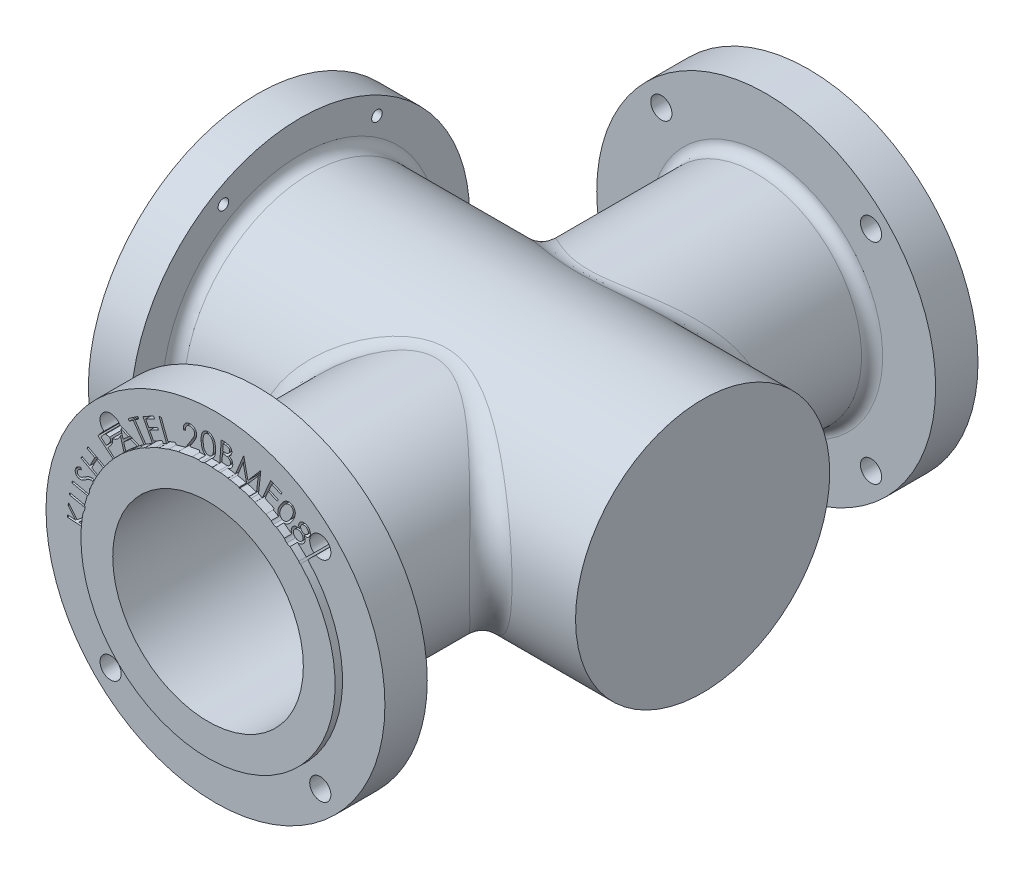
from build123d import *

# Parameters (mm, degrees)
SKETCH4_R          = 0.5
CUT_EXTRUDE1_DEPTH = 31.849473253
CUT_EXTRUDE2_REACH = 28.663
SKETCH5_R          = 0.25
SKETCH6_R          = 4.5
CUT_EXTRUDE3_DEPTH = 19
SKETCH4_3_R        = 4.5
CUT_EXTRUDE4_DEPTH = 33.119931507
FILLET1_R          = 1
CUT_EXTRUDE7_DEPTH = 2


with BuildPart() as part:
    # Sketch1 → Revolve1 (revolve)
    with BuildSketch(Plane(origin=(0, 0, 0), x_dir=(1, 0, 0), z_dir=(0, 1, 0))):
        with BuildLine():
            Line((0, -14.35), (6, -14.35))
            Line((6, -14.35), (6, -14))
            Line((6, -14), (8, -14))
            Line((8, -14), (8, -12))
            Line((8, -12), (5.5, -12))
            ThreePointArc((5.5, -12), (5.146446609, -11.853553391), (5, -11.5))
            Line((5, -11.5), (5, 11.5))
            ThreePointArc((5, 11.5), (5.146446609, 11.853553391), (5.5, 12))
            Line((5.5, 12), (8, 12))
            Line((8, 12), (8, 14))
            Line((8, 14), (6, 14))
            Line((6, 14), (6, 14.35))
            Line((6, 14.35), (0, 14.35))
            Line((0, 14.35), (0, -14.35))
        make_face()
    revolve(axis=Axis((0, 0, -14), (0, 0, 1)))

    # Sketch4 → Cut-Extrude1 (cut, through all)
    with BuildSketch(Plane.XY.offset(14.35)):
        with Locations((4.949747468, 4.949747468)):
            Circle(SKETCH4_R)
        with Locations((4.949747468, -4.949747468)):
            Circle(SKETCH4_R)
        with Locations((-4.949747468, -4.949747468)):
            Circle(SKETCH4_R)
        with Locations((-4.949747468, 4.949747468)):
            Circle(SKETCH4_R)
    extrude(amount=-CUT_EXTRUDE1_DEPTH, mode=Mode.SUBTRACT)

    # Sketch1<3> → Revolve2 (revolve)
    with BuildSketch(Plane(origin=(0, 0, 0), x_dir=(1, 0, 0), z_dir=(0, 1, 0))):
        with BuildLine():
            Line((-10, 0), (9, 0))
            Line((9, 0), (9, 6))
            Line((9, 6), (-9.5, 6))
            ThreePointArc((-9.5, 6), (-9.853553391, 6.146446609), (-10, 6.5))
            Line((-10, 6.5), (-10, 8))
            Line((-10, 8), (-12, 8))
            Line((-12, 8), (-12, 6))
            Line((-12, 6), (-11, 6))
            Line((-11, 6), (-11, 0))
            Line((-11, 0), (-10, 0))
        make_face()
    revolve(axis=Axis((-1024, 0, 0), (1, 0, 0)))

    # Sketch5 → Cut-Extrude2 (cut, up to next)
    with BuildSketch(Plane.ZY.offset(12), mode=Mode.PRIVATE) as cut_extrude2_sk1:
        with Locations((7.25, 0)):
            Circle(SKETCH5_R)
    cut_extrude2_tool1 = extrude(cut_extrude2_sk1.sketch, amount=-CUT_EXTRUDE2_REACH, mode=Mode.PRIVATE) & part.part
    # Sketch5 → Cut-Extrude2 (cut, up to next)
    with BuildSketch(Plane.ZY.offset(12), mode=Mode.PRIVATE) as cut_extrude2_sk2:
        with Locations((3.625, -6.278684177)):
            Circle(SKETCH5_R)
    cut_extrude2_tool2 = extrude(cut_extrude2_sk2.sketch, amount=-CUT_EXTRUDE2_REACH, mode=Mode.PRIVATE) & part.part
    # Sketch5 → Cut-Extrude2 (cut, up to next)
    with BuildSketch(Plane.ZY.offset(12), mode=Mode.PRIVATE) as cut_extrude2_sk3:
        with Locations((-3.625, -6.278684177)):
            Circle(SKETCH5_R)
    cut_extrude2_tool3 = extrude(cut_extrude2_sk3.sketch, amount=-CUT_EXTRUDE2_REACH, mode=Mode.PRIVATE) & part.part
    # Sketch5 → Cut-Extrude2 (cut, up to next)
    with BuildSketch(Plane.ZY.offset(12), mode=Mode.PRIVATE) as cut_extrude2_sk4:
        with Locations((-7.25, 0)):
            Circle(SKETCH5_R)
    cut_extrude2_tool4 = extrude(cut_extrude2_sk4.sketch, amount=-CUT_EXTRUDE2_REACH, mode=Mode.PRIVATE) & part.part
    # Sketch5 → Cut-Extrude2 (cut, up to next)
    with BuildSketch(Plane.ZY.offset(12), mode=Mode.PRIVATE) as cut_extrude2_sk5:
        with Locations((-3.625, 6.278684177)):
            Circle(SKETCH5_R)
    cut_extrude2_tool5 = extrude(cut_extrude2_sk5.sketch, amount=-CUT_EXTRUDE2_REACH, mode=Mode.PRIVATE) & part.part
    # Sketch5 → Cut-Extrude2 (cut, up to next)
    with BuildSketch(Plane.ZY.offset(12), mode=Mode.PRIVATE) as cut_extrude2_sk6:
        with Locations((3.625, 6.278684177)):
            Circle(SKETCH5_R)
    cut_extrude2_tool6 = extrude(cut_extrude2_sk6.sketch, amount=-CUT_EXTRUDE2_REACH, mode=Mode.PRIVATE) & part.part
    add(cut_extrude2_tool1.solids().sort_by_distance((-12, 0, 7.25))[0], mode=Mode.SUBTRACT)
    add(cut_extrude2_tool2.solids().sort_by_distance((-12, -6.278684, 3.625))[0], mode=Mode.SUBTRACT)
    add(cut_extrude2_tool3.solids().sort_by_distance((-12, -6.278684, -3.625))[0], mode=Mode.SUBTRACT)
    add(cut_extrude2_tool4.solids().sort_by_distance((-12, 0, -7.25))[0], mode=Mode.SUBTRACT)
    add(cut_extrude2_tool5.solids().sort_by_distance((-12, 6.278684, -3.625))[0], mode=Mode.SUBTRACT)
    add(cut_extrude2_tool6.solids().sort_by_distance((-12, 6.278684, 3.625))[0], mode=Mode.SUBTRACT)

    # Sketch6 → Cut-Extrude3 (cut)
    with BuildSketch(Plane.ZY.offset(11)):
        Circle(SKETCH6_R)
    extrude(amount=-CUT_EXTRUDE3_DEPTH, mode=Mode.SUBTRACT)

    # Sketch4<3> → Cut-Extrude4 (cut, through all)
    with BuildSketch(Plane.XY.offset(14.35)):
        Circle(SKETCH4_3_R)
    extrude(amount=-CUT_EXTRUDE4_DEPTH, mode=Mode.SUBTRACT)

    # Fillet1
    fillet1_edges = [part.edges().sort_by_distance(p)[0] for p in [
        (-5.000000001, 1e-09, 6.000000004),
        (0, 5, -3.31662479),
    ]]
    fillet(fillet1_edges, radius=FILLET1_R)

    # Sketch8 → Cut-Extrude7 (cut)
    # profile 1 of 17: a face of its own
    with BuildSketch(Plane.XY.offset(14.35)):
        Polygon((-6.986378205, 0.188701923), (-6.979366987, 0.290064103), (-6.606169872, 0.264623397), (-6.952323718, 0.687099359), (-6.943108974, 0.821514423), (-6.529447115, 0.313301282), (-5.946113782, 0.791065705), (-5.955128205, 0.659254808), (-6.448517628, 0.25400641), (-5.984775641, 0.222355769), (-5.991786859, 0.12099359), align=None)
    # profile 2 of 17: a face of its own
    with BuildSketch(Plane.XY.offset(14.35)):
        with BuildLine():
            Line((-6.89383186, 1.150157406), (-6.872798206, 1.247513175))
            Line((-6.872798206, 1.247513175), (-6.283455258, 1.120109329))
            add(Edge.make_bspline(
                [(-6.283455258, 1.120109329), (-6.275113129, 1.118284896), (-6.259312483, 1.114829277), (-6.236789655, 1.110248316), (-6.216696765, 1.106211393), (-6.1990805, 1.10280187), (-6.183847904, 1.10016267), (-6.171092175, 1.098164729), (-6.160744833, 1.096707811), (-6.154651037, 1.096121349), (-6.152045001, 1.095870547)],
                knots=[0, 0, 0, 0, 1.532957629, 2.90354203, 4.126002499, 5.212152315, 6.124598794, 6.901088842, 7.530046284, 8, 8, 8, 8], degree=3))
            add(Edge.make_bspline(
                [(-6.152045001, 1.095870547), (-6.142431305, 1.095328928), (-6.123856776, 1.094282471), (-6.096774497, 1.096147051), (-6.071510455, 1.100642662), (-6.047835243, 1.108302266), (-6.025466726, 1.119632168), (-6.004208802, 1.134817655), (-5.983820633, 1.153941471), (-5.964895702, 1.176473373), (-5.947585811, 1.201103346), (-5.933346901, 1.227169714), (-5.922284284, 1.254058721), (-5.917465799, 1.272555308), (-5.915065835, 1.281767982)],
                knots=[0, 0, 0, 0, 1.045648797, 2.020287966, 2.942650699, 3.828489792, 4.714507224, 5.656837994, 6.658130493, 7.74439148, 8.849613514, 9.924567605, 10.966280446, 12, 12, 12, 12], degree=3))
            add(Edge.make_bspline(
                [(-5.915065835, 1.281767982), (-5.913613019, 1.289824832), (-5.910711362, 1.305916483), (-5.909667142, 1.330387798), (-5.910974814, 1.354915983), (-5.91532614, 1.379176399), (-5.921663609, 1.402937261), (-5.931153395, 1.425309811), (-5.942437452, 1.446489708), (-5.956539148, 1.466056441), (-5.97266066, 1.48432535), (-5.991409709, 1.50081688), (-6.012199405, 1.516043789), (-6.027602648, 1.524334503), (-6.035458463, 1.528562854)],
                knots=[0, 0, 0, 0, 0.994086842, 1.985453153, 2.969148558, 3.973879984, 4.976149835, 5.951337553, 6.921004498, 7.887132501, 8.875904043, 9.876134418, 10.916806393, 12, 12, 12, 12], degree=3))
            add(Edge.make_bspline(
                [(-6.035458463, 1.528562854), (-6.038776983, 1.530145465), (-6.046160516, 1.533666691), (-6.058803499, 1.538317002), (-6.073873433, 1.543259992), (-6.091303085, 1.548779407), (-6.111393744, 1.554081262), (-6.134002749, 1.559597983), (-6.159047177, 1.565754168), (-6.176672498, 1.569480663), (-6.185899168, 1.571431444)],
                knots=[0, 0, 0, 0, 0.562762342, 1.252116398, 2.060496101, 2.991951591, 4.051095601, 5.241496129, 6.555952349, 8, 8, 8, 8], degree=3))
            Line((-6.185899168, 1.571431444), (-6.775242117, 1.69883529))
            Line((-6.775242117, 1.69883529), (-6.754208463, 1.79639138))
            Line((-6.754208463, 1.79639138), (-6.164865514, 1.668987534))
            add(Edge.make_bspline(
                [(-6.164865514, 1.668987534), (-6.15423107, 1.666657567), (-6.133486481, 1.662112505), (-6.103454501, 1.654235979), (-6.075136973, 1.646007359), (-6.04848372, 1.637503919), (-6.023650576, 1.628266119), (-6.000541976, 1.618617234), (-5.979056846, 1.608711569), (-5.959265668, 1.597991143), (-5.940654771, 1.586480892), (-5.923363392, 1.573471521), (-5.906928443, 1.559167284), (-5.891689527, 1.543191269), (-5.877323439, 1.525880704), (-5.864023298, 1.507009664), (-5.851586092, 1.486867823), (-5.840495948, 1.465272559), (-5.83051475, 1.442796125), (-5.823031882, 1.419317231), (-5.817354312, 1.395347444), (-5.813700205, 1.370759392), (-5.812317279, 1.345546309), (-5.813234997, 1.319699073), (-5.815940132, 1.293299794), (-5.819375939, 1.275670029), (-5.821115514, 1.266743944)],
                knots=[0, 0, 0, 0, 1.301440194, 2.538716735, 3.710954634, 4.826818693, 5.882641336, 6.877457842, 7.820308208, 8.709733787, 9.566941146, 10.433906613, 11.293786257, 12.168909599, 13.070433856, 13.980821628, 14.92691088, 15.898096168, 16.881346332, 17.863396679, 18.839327867, 19.823808754, 20.831229657, 21.853564497, 22.913243158, 24, 24, 24, 24], degree=3))
            add(Edge.make_bspline(
                [(-5.821115514, 1.266743944), (-5.823397095, 1.257096139), (-5.827871166, 1.238177252), (-5.836578919, 1.210735062), (-5.846762605, 1.184778119), (-5.858341117, 1.16009293), (-5.871889682, 1.137115007), (-5.886612936, 1.115329174), (-5.903259914, 1.095291408), (-5.920911874, 1.076458327), (-5.939929303, 1.059497464), (-5.959800036, 1.044385583), (-5.980465125, 1.031349529), (-6.001909087, 1.020237623), (-6.024042711, 1.010950949), (-6.047050012, 1.004081864), (-6.070633717, 0.998564132), (-6.086779073, 0.996935518), (-6.094953655, 0.996110931)],
                knots=[0, 0, 0, 0, 1.150827783, 2.256718528, 3.339427705, 4.386775717, 5.418685421, 6.433738576, 7.436398037, 8.44004624, 9.42839463, 10.391358605, 11.335664093, 12.261551904, 13.193135547, 14.117723957, 15.046981706, 16, 16, 16, 16], degree=3))
            add(Edge.make_bspline(
                [(-6.094953655, 0.996110931), (-6.100494039, 0.995762995), (-6.112436538, 0.995013005), (-6.131840136, 0.995624037), (-6.153895768, 0.997201978), (-6.178720127, 1.000197638), (-6.206283344, 1.003841807), (-6.236547403, 1.009284143), (-6.26963665, 1.01538498), (-6.292547065, 1.020228775), (-6.304488912, 1.022753559)],
                knots=[0, 0, 0, 0, 0.628687708, 1.355159219, 2.197137972, 3.133736281, 4.187661874, 5.346904728, 6.617098126, 8, 8, 8, 8], degree=3))
            Line((-6.304488912, 1.022753559), (-6.89383186, 1.150157406))
        make_face()
    # profile 3 of 17: a face of its own
    with BuildSketch(Plane.XY.offset(14.35)):
        with BuildLine():
            Line((-5.921266068, 1.785307668), (-5.940296517, 1.882463117))
            add(Edge.make_bspline(
                [(-5.940296517, 1.882463117), (-5.925548339, 1.885001654), (-5.897332042, 1.889858397), (-5.857692202, 1.901036532), (-5.822303109, 1.914163946), (-5.79164964, 1.930477477), (-5.76530141, 1.949097951), (-5.743860969, 1.97065239), (-5.726302296, 1.994519518), (-5.718863129, 2.012485146), (-5.715136261, 2.021485553)],
                knots=[0, 0, 0, 0, 1.291542476, 2.470986435, 3.551556088, 4.544751696, 5.461789055, 6.326226313, 7.161474144, 8, 8, 8, 8], degree=3))
            add(Edge.make_bspline(
                [(-5.715136261, 2.021485553), (-5.712599728, 2.029378983), (-5.707575435, 2.045014068), (-5.703579985, 2.069277798), (-5.702866252, 2.093705362), (-5.704871253, 2.118027254), (-5.709455236, 2.141737571), (-5.717412941, 2.163915897), (-5.727843021, 2.184425963), (-5.741116325, 2.202840095), (-5.756567972, 2.218970225), (-5.773466483, 2.232999906), (-5.792096994, 2.244421131), (-5.805528179, 2.249897629), (-5.812291709, 2.252655424)],
                knots=[0, 0, 0, 0, 1.069680766, 2.118793553, 3.162825689, 4.218439843, 5.26531734, 6.271775718, 7.251424329, 8.227841336, 9.191609424, 10.129052576, 11.057848535, 12, 12, 12, 12], degree=3))
            add(Edge.make_bspline(
                [(-5.812291709, 2.252655424), (-5.820311372, 2.255075979), (-5.836504847, 2.259963614), (-5.862359571, 2.262126864), (-5.88931566, 2.260346891), (-5.907222416, 2.25606557), (-5.916458376, 2.253857347)],
                knots=[0, 0, 0, 0, 0.948140302, 1.914505363, 2.924341997, 4, 4, 4, 4], degree=3))
            add(Edge.make_bspline(
                [(-5.916458376, 2.253857347), (-5.923300139, 2.251811119), (-5.937677663, 2.2475111), (-5.959639525, 2.238864975), (-5.983401635, 2.228739804), (-6.00850997, 2.216128219), (-6.035491822, 2.202000497), (-6.063819858, 2.185358927), (-6.094099613, 2.167319929), (-6.114484957, 2.154100454), (-6.12499203, 2.147286835)],
                knots=[0, 0, 0, 0, 0.729038284, 1.532027095, 2.408696707, 3.366372863, 4.400564, 5.518828321, 6.721147285, 8, 8, 8, 8], degree=3))
            add(Edge.make_bspline(
                [(-6.12499203, 2.147286835), (-6.135451674, 2.140505359), (-6.155473312, 2.127524397), (-6.184488368, 2.10954251), (-6.210920116, 2.093691961), (-6.234776298, 2.079966578), (-6.256170056, 2.068572283), (-6.274933039, 2.059246433), (-6.291260802, 2.052279737), (-6.301453798, 2.048873465), (-6.306081773, 2.047326899)],
                knots=[0, 0, 0, 0, 1.44291698, 2.762002399, 3.95103348, 5.010398315, 5.947461928, 6.756346721, 7.43533801, 8, 8, 8, 8], degree=3))
            add(Edge.make_bspline(
                [(-6.306081773, 2.047326899), (-6.313000094, 2.045353317), (-6.326721263, 2.041439094), (-6.347488716, 2.037460308), (-6.368060817, 2.035250753), (-6.388418356, 2.034657215), (-6.408604388, 2.035562441), (-6.428544867, 2.038498646), (-6.448306622, 2.042768195), (-6.461099553, 2.047132773), (-6.467540107, 2.049330104)],
                knots=[0, 0, 0, 0, 1.049962564, 2.082400182, 3.08252884, 4.067577515, 5.053397718, 6.028117244, 7.007263024, 8, 8, 8, 8], degree=3))
            add(Edge.make_bspline(
                [(-6.467540107, 2.049330104), (-6.47741578, 2.05327181), (-6.49689887, 2.061048152), (-6.523650079, 2.077201261), (-6.548050142, 2.096123629), (-6.569398905, 2.118344285), (-6.587499481, 2.143203167), (-6.601819814, 2.170360364), (-6.612536393, 2.19944185), (-6.619289346, 2.230245299), (-6.621983016, 2.261952389), (-6.621084712, 2.293847897), (-6.615904209, 2.325605171), (-6.609299752, 2.346075089), (-6.605961581, 2.35642145)],
                knots=[0, 0, 0, 0, 1.017242832, 2.006853819, 2.982009248, 3.968306335, 4.948484919, 5.918612277, 6.900230261, 7.909131171, 8.930228882, 9.941499986, 10.959547121, 12, 12, 12, 12], degree=3))
            add(Edge.make_bspline(
                [(-6.605961581, 2.35642145), (-6.601662473, 2.367253735), (-6.593157377, 2.388683677), (-6.575023285, 2.418127061), (-6.553717446, 2.445221947), (-6.53275814, 2.465596258), (-6.513651108, 2.480399496), (-6.497443933, 2.491281653), (-6.479504257, 2.501888812), (-6.459606419, 2.511786921), (-6.438104491, 2.52145199), (-6.414775191, 2.530668391), (-6.389626595, 2.539422591), (-6.372139207, 2.544780253), (-6.36317312, 2.547527219)],
                knots=[0, 0, 0, 0, 1.299858522, 2.571561987, 3.846150426, 5.143973717, 5.824429192, 6.544462836, 7.323629782, 8.151015956, 9.025872352, 9.956787822, 10.952409612, 12, 12, 12, 12], degree=3))
            Line((-6.36317312, 2.547527219), (-6.332724402, 2.449971129))
            add(Edge.make_bspline(
                [(-6.332724402, 2.449971129), (-6.339880043, 2.447667102), (-6.353709908, 2.443214058), (-6.373501642, 2.436250042), (-6.391589977, 2.429197845), (-6.408096168, 2.422266069), (-6.422894771, 2.415024281), (-6.436115549, 2.407894153), (-6.447688658, 2.400680956), (-6.460624098, 2.390883932), (-6.474552408, 2.377663364), (-6.489123874, 2.360305343), (-6.500752907, 2.340736568), (-6.506508741, 2.326653839), (-6.509407094, 2.319562476)],
                knots=[0, 0, 0, 0, 1.18227372, 2.28500623, 3.29911749, 4.235422685, 5.099633425, 5.889151834, 6.597143472, 7.241953614, 8.438091905, 9.609259377, 10.796141642, 12, 12, 12, 12], degree=3))
            add(Edge.make_bspline(
                [(-6.509407094, 2.319562476), (-6.512289941, 2.310361681), (-6.517864291, 2.292570778), (-6.520355886, 2.265160297), (-6.517221031, 2.238836867), (-6.50931923, 2.213982192), (-6.496593624, 2.191798535), (-6.480425903, 2.17261378), (-6.460020997, 2.157615537), (-6.444463012, 2.151051283), (-6.436490427, 2.147687476)],
                knots=[0, 0, 0, 0, 1.106985595, 2.140497038, 3.138155866, 4.139062771, 5.119537815, 6.06192598, 7.006846904, 8, 8, 8, 8], degree=3))
            add(Edge.make_bspline(
                [(-6.436490427, 2.147687476), (-6.431378933, 2.146038034), (-6.42115278, 2.142738128), (-6.405211755, 2.139824244), (-6.38897857, 2.138355378), (-6.372175874, 2.138786203), (-6.354357188, 2.141265704), (-6.335231684, 2.146243097), (-6.31439444, 2.153226132), (-6.3004185, 2.159571401), (-6.29306094, 2.162911835)],
                knots=[0, 0, 0, 0, 0.868076149, 1.736689806, 2.614922363, 3.500959234, 4.449640816, 5.5185591, 6.693658449, 8, 8, 8, 8], degree=3))
            add(Edge.make_bspline(
                [(-6.29306094, 2.162911835), (-6.290583886, 2.164235572), (-6.284571224, 2.167448738), (-6.274262436, 2.173426391), (-6.261232571, 2.181537751), (-6.245424826, 2.191479356), (-6.227023785, 2.203682626), (-6.205500301, 2.21729731), (-6.181591068, 2.233488206), (-6.164600001, 2.244726545), (-6.155641068, 2.250652219)],
                knots=[0, 0, 0, 0, 0.413285909, 1.003186829, 1.753140866, 2.671827171, 3.751102741, 5.002162888, 6.41932114, 8, 8, 8, 8], degree=3))
            add(Edge.make_bspline(
                [(-6.155641068, 2.250652219), (-6.14471844, 2.257773853), (-6.123550113, 2.271575757), (-6.092401931, 2.290871101), (-6.062570193, 2.307788133), (-6.034258574, 2.322591701), (-6.007419084, 2.335294005), (-5.982062522, 2.345736164), (-5.958285277, 2.354351132), (-5.935593954, 2.360388642), (-5.913938581, 2.364517289), (-5.893042777, 2.367718946), (-5.872542867, 2.369048505), (-5.852532483, 2.369087554), (-5.833043253, 2.367703956), (-5.814099776, 2.364864449), (-5.795587131, 2.360726857), (-5.783617529, 2.356787435), (-5.777636261, 2.354818886)],
                knots=[0, 0, 0, 0, 1.537185454, 2.979103843, 4.318721159, 5.579214294, 6.744818953, 7.817830336, 8.811223562, 9.723960709, 10.5823265, 11.409479176, 12.214305086, 13.00149854, 13.76706188, 14.515185624, 15.25803102, 16, 16, 16, 16], degree=3))
            add(Edge.make_bspline(
                [(-5.777636261, 2.354818886), (-5.7693475, 2.351584138), (-5.752925955, 2.345175513), (-5.729817464, 2.332649505), (-5.708501202, 2.317889178), (-5.688764648, 2.301319617), (-5.670944916, 2.282342438), (-5.654757999, 2.261355189), (-5.640307772, 2.238188163), (-5.627792396, 2.213302324), (-5.617473166, 2.187293176), (-5.609525084, 2.160773803), (-5.604561226, 2.133973781), (-5.602065983, 2.107010753), (-5.602511209, 2.079751795), (-5.605739003, 2.052310427), (-5.61176691, 2.024675369), (-5.617749076, 2.006614041), (-5.620785299, 1.997447091)],
                knots=[0, 0, 0, 0, 0.98476517, 1.950999249, 2.902861342, 3.852652542, 4.799559987, 5.780317957, 6.783762581, 7.818999767, 8.86137143, 9.879319484, 10.880171612, 11.875159053, 12.873685873, 13.893780933, 14.930997517, 16, 16, 16, 16], degree=3))
            add(Edge.make_bspline(
                [(-5.620785299, 1.997447091), (-5.623406868, 1.990453263), (-5.628608561, 1.976576172), (-5.638420444, 1.956733213), (-5.649113492, 1.937711268), (-5.661216331, 1.919740031), (-5.674686753, 1.902926301), (-5.689338675, 1.88705105), (-5.705219989, 1.872206371), (-5.722349934, 1.858250959), (-5.741004263, 1.845393987), (-5.761507397, 1.833752284), (-5.783663271, 1.822900396), (-5.8077737, 1.813415686), (-5.833560967, 1.804712169), (-5.861145799, 1.797230259), (-5.890537271, 1.79051506), (-5.910829767, 1.787076234), (-5.921266068, 1.785307668)],
                knots=[0, 0, 0, 0, 0.922194353, 1.829809992, 2.731256421, 3.616707685, 4.503080733, 5.390412957, 6.283364287, 7.186507682, 8.117807448, 9.078599656, 10.096884565, 11.163062804, 12.276969051, 13.457750052, 14.692537049, 16, 16, 16, 16], degree=3))
        make_face()
    # profile 4 of 17: a face of its own
    with BuildSketch(Plane.XY.offset(14.35)):
        Polygon((-6.346308219, 2.924749148), (-6.29983386, 3.013691456), (-5.929040591, 2.81998152), (-5.694064629, 3.269500751), (-6.064857898, 3.463210686), (-6.018383539, 3.552152994), (-5.134369116, 3.090013571), (-5.180843475, 3.001071263), (-5.607526167, 3.224228315), (-5.842502129, 2.774709084), (-5.415819437, 2.551552033), (-5.462293796, 2.462609725), align=None)
    # profile 5 of 17: a face of its own
    with BuildSketch(Plane.XY.offset(14.35)):
        with BuildLine():
            Line((-5.550941717, 4.238857382), (-5.424940115, 4.391100972))
            add(Edge.make_bspline(
                [(-5.424940115, 4.391100972), (-5.416310019, 4.401560495), (-5.39975585, 4.421623854), (-5.37520618, 4.449730379), (-5.352952743, 4.475263768), (-5.332220515, 4.497556819), (-5.313382466, 4.516918601), (-5.296723553, 4.533745144), (-5.281468502, 4.547167751), (-5.271723564, 4.554864981), (-5.267287871, 4.5583686)],
                knots=[0, 0, 0, 0, 1.413369586, 2.711112281, 3.889678649, 4.943627424, 5.883760668, 6.705675344, 7.410850419, 8, 8, 8, 8], degree=3))
            add(Edge.make_bspline(
                [(-5.267287871, 4.5583686), (-5.261475571, 4.562536818), (-5.249946816, 4.57080452), (-5.231716023, 4.581412229), (-5.212935784, 4.590166607), (-5.193893919, 4.597794338), (-5.174164174, 4.603219671), (-5.154132251, 4.607603463), (-5.133598456, 4.609900956), (-5.112773746, 4.61075228), (-5.091775035, 4.609804403), (-5.070938254, 4.606733697), (-5.050334792, 4.601932658), (-5.030073696, 4.595101295), (-5.010122451, 4.586187759), (-4.99045038, 4.575294752), (-4.971012088, 4.562515159), (-4.958656152, 4.552722545), (-4.952384025, 4.547751613)],
                knots=[0, 0, 0, 0, 1.004276471, 1.99199234, 2.956957625, 3.913177165, 4.869120675, 5.827499713, 6.790776997, 7.766936045, 8.752869031, 9.738400425, 10.721205586, 11.720740736, 12.736860294, 13.786326414, 14.876293924, 16, 16, 16, 16], degree=3))
            add(Edge.make_bspline(
                [(-4.952384025, 4.547751613), (-4.946205641, 4.542519332), (-4.934076972, 4.532247939), (-4.917964281, 4.515268541), (-4.90339332, 4.498027287), (-4.890697833, 4.480190764), (-4.88006734, 4.461728362), (-4.871331499, 4.442687035), (-4.864565304, 4.42307822), (-4.859547207, 4.402970401), (-4.856267586, 4.382594819), (-4.855215264, 4.36200378), (-4.855441682, 4.341282525), (-4.858067108, 4.320414012), (-4.861887369, 4.299310978), (-4.868164187, 4.278254797), (-4.875566822, 4.256893622), (-4.88213766, 4.243075363), (-4.885476974, 4.236052895)],
                knots=[0, 0, 0, 0, 1.118276287, 2.195267141, 3.230436997, 4.236817521, 5.216738488, 6.170760861, 7.128125609, 8.079465628, 9.032371271, 9.975392665, 10.926195304, 11.892416529, 12.878921779, 13.886782431, 14.926058491, 16, 16, 16, 16], degree=3))
            add(Edge.make_bspline(
                [(-4.885476974, 4.236052895), (-4.88842234, 4.230410645), (-4.894834377, 4.218127512), (-4.906661353, 4.198880792), (-4.921063883, 4.177082347), (-4.938404965, 4.152839925), (-4.958479628, 4.126073563), (-4.981059334, 4.096591652), (-5.006539135, 4.064817744), (-5.024541892, 4.042923971), (-5.033914474, 4.031525651)],
                knots=[0, 0, 0, 0, 0.60329799, 1.313374853, 2.140398994, 3.080211623, 4.138740126, 5.312570504, 6.60087243, 8, 8, 8, 8], degree=3))
            Line((-5.033914474, 4.031525651), (-5.078986589, 3.977038472))
            Line((-5.078986589, 3.977038472), (-4.723618, 3.682967959))
            Line((-4.723618, 3.682967959), (-4.786718961, 3.606645844))
            Line((-4.786718961, 3.606645844), (-5.550941717, 4.238857382))
        make_face()
        with BuildLine():
            Line((-5.413722166, 4.253881421), (-5.153906461, 4.03893751))
            Line((-5.153906461, 4.03893751), (-5.045132423, 4.166942318))
            add(Edge.make_bspline(
                [(-5.045132423, 4.166942318), (-5.039940498, 4.17324618), (-5.029899913, 4.185437124), (-5.016176487, 4.203737157), (-5.003617752, 4.220897638), (-4.992895584, 4.237274412), (-4.983551321, 4.25261032), (-4.975709449, 4.26694469), (-4.969436447, 4.280469506), (-4.963028604, 4.297047681), (-4.958093193, 4.31734764), (-4.955661811, 4.341602075), (-4.957646778, 4.365666873), (-4.963035265, 4.389283857), (-4.971870902, 4.411971281), (-4.983893774, 4.433069256), (-4.999183335, 4.452335136), (-5.01143768, 4.463255136), (-5.017688512, 4.468825331)],
                knots=[0, 0, 0, 0, 1.134336033, 2.193675464, 3.177111676, 4.087866661, 4.911922381, 5.671482984, 6.356279105, 6.981638939, 8.138024127, 9.246579916, 10.353582235, 11.476444054, 12.601296494, 13.723084978, 14.838566044, 16, 16, 16, 16], degree=3))
            add(Edge.make_bspline(
                [(-5.017688512, 4.468825331), (-5.024162692, 4.473774839), (-5.036983069, 4.483576011), (-5.058555743, 4.494564047), (-5.081383042, 4.502565613), (-5.105252531, 4.506714191), (-5.129253136, 4.50820227), (-5.152699296, 4.505450741), (-5.175236318, 4.499449033), (-5.193246328, 4.491278593), (-5.207469903, 4.482530666), (-5.218964279, 4.474204644), (-5.231096261, 4.464191508), (-5.243970227, 4.45246696), (-5.25758646, 4.439081991), (-5.271714947, 4.423759247), (-5.286772223, 4.407013117), (-5.296771879, 4.395072617), (-5.30194332, 4.388897446)],
                knots=[0, 0, 0, 0, 1.158579028, 2.294255006, 3.431085105, 4.591302253, 5.733925054, 6.843988252, 7.93747016, 9.044065359, 9.645904889, 10.313637995, 11.063721388, 11.885110351, 12.792952066, 13.782035355, 14.852953311, 16, 16, 16, 16], degree=3))
            Line((-5.30194332, 4.388897446), (-5.413722166, 4.253881421))
        make_face(mode=Mode.SUBTRACT)
    # profile 6 of 17: a face of its own
    with BuildSketch(Plane.XY.offset(14.35)):
        Polygon((-4.600917766, 5.238498582), (-3.595509112, 4.799596339), (-3.675637317, 4.728883198), (-4.009170971, 4.870910441), (-4.330685394, 4.587456916), (-4.230925779, 4.239299864), (-4.314058791, 4.165982557), (-4.619146933, 5.222472941), align=None)
        Polygon((-4.470709433, 5.072633198), (-4.360733471, 4.689019416), (-4.105525138, 4.914179672), align=None, mode=Mode.SUBTRACT)
    # profile 7 of 17: a face of its own
    with BuildSketch(Plane.XY.offset(14.35)):
        Polygon((-4.065430381, 5.574092318), (-4.120318202, 5.653619562), (-3.670798971, 5.964717318), (-3.615911151, 5.885190075), (-3.798603458, 5.758787831), (-3.286183587, 5.018803857), (-3.36971724, 4.960911228), (-3.882137112, 5.700895203), align=None)
    # profile 8 of 17: a face of its own
    with BuildSketch(Plane.XY.offset(14.35)):
        Polygon((-3.427392705, 6.089496819), (-2.920782128, 6.350915088), (-2.875910333, 6.263775665), (-3.294179564, 6.047830153), (-3.151351038, 5.771387845), (-2.736687577, 5.985530473), (-2.692016103, 5.898992011), (-3.106679564, 5.684849383), (-2.927793346, 5.338094576), (-2.513129885, 5.552237204), (-2.468057769, 5.465097781), (-2.971062577, 5.205482396), align=None)
    # profile 9 of 17: a face of its own
    with BuildSketch(Plane.XY.offset(14.35)):
        Polygon((-2.658971585, 6.462726663), (-2.565421906, 6.498183394), (-2.247913893, 5.657838842), (-1.890742419, 5.792654548), (-1.856888252, 5.702910958), (-2.307609406, 5.532638522), align=None)
    # profile 10 of 17: a face of its own
    with BuildSketch(Plane.XY.offset(14.35)):
        with BuildLine():
            Line((-1.415887807, 6.521239028), (-1.509437486, 6.504011464))
            add(Edge.make_bspline(
                [(-1.509437486, 6.504011464), (-1.511067603, 6.515943422), (-1.514263119, 6.539333615), (-1.51510085, 6.574148068), (-1.513247448, 6.607891652), (-1.5079425, 6.640461555), (-1.499992975, 6.672056425), (-1.488670066, 6.702359189), (-1.474374747, 6.731652819), (-1.456959215, 6.759449418), (-1.437351978, 6.785551429), (-1.415561836, 6.809199762), (-1.391804694, 6.830156597), (-1.366137982, 6.848384887), (-1.338622743, 6.863976199), (-1.309203504, 6.876782883), (-1.277885678, 6.887113146), (-1.256084701, 6.891704211), (-1.245014409, 6.894035502)],
                knots=[0, 0, 0, 0, 1.100230273, 2.156779222, 3.178085263, 4.185725765, 5.168862013, 6.152017213, 7.137614286, 8.143848398, 9.146241945, 10.11826572, 11.078466506, 12.03721075, 12.991279115, 13.964433252, 14.966361965, 16, 16, 16, 16], degree=3))
            add(Edge.make_bspline(
                [(-1.245014409, 6.894035502), (-1.234019583, 6.895752181), (-1.212448511, 6.899120184), (-1.180249145, 6.901006626), (-1.149135143, 6.899506634), (-1.119079499, 6.895468437), (-1.090277836, 6.887951814), (-1.062618944, 6.877451939), (-1.036031882, 6.863940062), (-1.010828391, 6.847563406), (-0.987347781, 6.82912421), (-0.966217612, 6.808888468), (-0.947160874, 6.787510962), (-0.930994367, 6.76422986), (-0.916792958, 6.73981243), (-0.905435524, 6.713758166), (-0.896216387, 6.686360955), (-0.892256975, 6.667322916), (-0.890246781, 6.657657297)],
                knots=[0, 0, 0, 0, 1.121414891, 2.200136782, 3.244562734, 4.257449553, 5.2517348, 6.238127589, 7.234575145, 8.252170548, 9.263512837, 10.23956163, 11.198279964, 12.145132898, 13.091937975, 14.041276092, 15.005555265, 16, 16, 16, 16], degree=3))
            add(Edge.make_bspline(
                [(-0.890246781, 6.657657297), (-0.888209055, 6.64393344), (-0.884168059, 6.616717794), (-0.884625192, 6.575402125), (-0.890016098, 6.534493207), (-0.899029411, 6.500551533), (-0.909231363, 6.472695317), (-0.918848538, 6.449598766), (-0.930833937, 6.424681895), (-0.944388485, 6.397421085), (-0.96055658, 6.368412977), (-0.978304441, 6.337034419), (-0.998405987, 6.303850806), (-1.012675309, 6.281166823), (-1.020054473, 6.269436143)],
                knots=[0, 0, 0, 0, 1.187328871, 2.354580148, 3.526324396, 4.715705695, 5.354623197, 6.067641564, 6.858527512, 7.723420889, 8.675985074, 9.703624978, 10.812464348, 12, 12, 12, 12], degree=3))
            Line((-1.020054473, 6.269436143), (-1.214565691, 5.962745438))
            Line((-1.214565691, 5.962745438), (-0.764044858, 6.04547781))
            Line((-0.764044858, 6.04547781), (-0.746817294, 5.951327169))
            Line((-0.746817294, 5.951327169), (-1.409677871, 5.829532297))
            Line((-1.409677871, 5.829532297), (-1.110599345, 6.300886464))
            add(Edge.make_bspline(
                [(-1.110599345, 6.300886464), (-1.103353837, 6.312283477), (-1.089386668, 6.334253506), (-1.069844715, 6.366189981), (-1.052295458, 6.395744196), (-1.036935423, 6.422860161), (-1.023602509, 6.447518434), (-1.012565165, 6.469793725), (-1.003507289, 6.489619202), (-0.994044485, 6.512615893), (-0.98628515, 6.54018087), (-0.980823955, 6.572961458), (-0.980083439, 6.605856624), (-0.983226256, 6.62743452), (-0.984798063, 6.638226208)],
                knots=[0, 0, 0, 0, 1.317001447, 2.538784396, 3.651094325, 4.668783933, 5.577751231, 6.384420757, 7.092557274, 7.70320576, 8.807865072, 9.876269259, 10.937865085, 12, 12, 12, 12], degree=3))
            add(Edge.make_bspline(
                [(-0.984798063, 6.638226208), (-0.986197093, 6.644938682), (-0.988962891, 6.658208841), (-0.995442791, 6.677278416), (-1.003711841, 6.695265706), (-1.013797646, 6.712176461), (-1.025624717, 6.728071238), (-1.039404736, 6.742763119), (-1.054912272, 6.756426594), (-1.071955032, 6.768874593), (-1.09007534, 6.779891818), (-1.108994643, 6.788961115), (-1.128465188, 6.795983386), (-1.148455804, 6.801026984), (-1.168923879, 6.804109922), (-1.189929162, 6.804736022), (-1.211463531, 6.803884409), (-1.225865651, 6.801632112), (-1.233195499, 6.800485823)],
                knots=[0, 0, 0, 0, 0.996595439, 1.970209317, 2.921922716, 3.871353705, 4.828995608, 5.797947767, 6.795678389, 7.831082899, 8.863796325, 9.875982123, 10.877534488, 11.869243347, 12.870560224, 13.881393798, 14.921751664, 16, 16, 16, 16], degree=3))
            add(Edge.make_bspline(
                [(-1.233195499, 6.800485823), (-1.24077961, 6.79889691), (-1.255727167, 6.795765314), (-1.277128596, 6.788609684), (-1.297397103, 6.78012572), (-1.316038066, 6.769301937), (-1.333604621, 6.757136185), (-1.349715564, 6.743009766), (-1.364383435, 6.727021353), (-1.377778664, 6.70952577), (-1.389433167, 6.690376962), (-1.39924377, 6.669921268), (-1.407170199, 6.648207807), (-1.412559785, 6.625170791), (-1.416787484, 6.601047993), (-1.418408598, 6.575552247), (-1.418222846, 6.548774836), (-1.416679987, 6.530580761), (-1.415887807, 6.521239028)],
                knots=[0, 0, 0, 0, 1.000581647, 1.972050723, 2.911369446, 3.835060076, 4.751954011, 5.669253921, 6.597448032, 7.551866023, 8.512350291, 9.488827071, 10.479686842, 11.492657202, 12.542448545, 13.641109363, 14.788829617, 16, 16, 16, 16], degree=3))
        make_face()
    # profile 11 of 17: a face of its own
    with BuildSketch(Plane.XY.offset(14.35)):
        with BuildLine():
            add(Edge.make_bspline(
                [(-0.674102633, 6.459074704), (-0.674829095, 6.475030738), (-0.676238988, 6.505997654), (-0.676227019, 6.551091818), (-0.675554787, 6.593471996), (-0.672529372, 6.63314235), (-0.668795581, 6.670150191), (-0.663111944, 6.704373491), (-0.656183561, 6.73589885), (-0.647764235, 6.764949715), (-0.63784814, 6.791801835), (-0.626722216, 6.816873136), (-0.614925816, 6.840637221), (-0.601263536, 6.862456223), (-0.587019665, 6.883009419), (-0.57118925, 6.901706914), (-0.554416024, 6.919025143), (-0.536341748, 6.934556842), (-0.517549944, 6.948683897), (-0.497830018, 6.960864005), (-0.477553429, 6.971520457), (-0.456645956, 6.980640652), (-0.434981896, 6.987845173), (-0.412648652, 6.993182359), (-0.389769956, 6.997152055), (-0.374238067, 6.998206665), (-0.366410325, 6.998738165)],
                knots=[0, 0, 0, 0, 1.64556112, 3.193647602, 4.645801909, 6.011505722, 7.29178083, 8.477193657, 9.583919874, 10.615967335, 11.591177859, 12.530788289, 13.441592507, 14.32189666, 15.180917321, 16.016047168, 16.843174529, 17.662596816, 18.468974596, 19.263196791, 20.047975224, 20.827639856, 21.610908808, 22.396892738, 23.192068024, 24, 24, 24, 24], degree=3))
            add(Edge.make_bspline(
                [(-0.366410325, 6.998738165), (-0.358462223, 6.999023508), (-0.34268246, 6.999590013), (-0.319185114, 6.997757923), (-0.296133032, 6.994674155), (-0.273606523, 6.989661522), (-0.251652695, 6.98267378), (-0.229950088, 6.974436019), (-0.208972842, 6.96385583), (-0.188419224, 6.951854839), (-0.16859694, 6.937988292), (-0.149513032, 6.922449074), (-0.131672453, 6.90472492), (-0.114364674, 6.88565457), (-0.098387356, 6.864390073), (-0.083111891, 6.841571833), (-0.068904218, 6.816854701), (-0.055678989, 6.790296706), (-0.043266047, 6.7617167), (-0.032606653, 6.730580202), (-0.023027372, 6.697074834), (-0.014510222, 6.661149961), (-0.007898988, 6.622648813), (-0.002311142, 6.581758465), (0.002176734, 6.538471308), (0.003899971, 6.508763118), (0.004783585, 6.493529832)],
                knots=[0, 0, 0, 0, 0.813536462, 1.61515445, 2.408805851, 3.193219482, 3.973691911, 4.765781671, 5.566699913, 6.375599818, 7.200457923, 8.040665499, 8.891400776, 9.772408456, 10.674717117, 11.611252103, 12.582034029, 13.590816833, 14.647224041, 15.769179429, 16.956920752, 18.213700585, 19.546530676, 20.954041234, 22.438142453, 24, 24, 24, 24], degree=3))
            add(Edge.make_bspline(
                [(0.004783585, 6.493529832), (0.005411168, 6.478308205), (0.006632944, 6.448674803), (0.006866647, 6.405310329), (0.005511678, 6.364276566), (0.002562354, 6.325501027), (-0.002056106, 6.28907759), (-0.007965943, 6.254874884), (-0.015568445, 6.223040099), (-0.024582855, 6.19339282), (-0.035084909, 6.16580734), (-0.046738915, 6.139964403), (-0.059247399, 6.115631931), (-0.073225771, 6.093080136), (-0.088146223, 6.072025146), (-0.104396125, 6.052689026), (-0.122004428, 6.035278021), (-0.140313683, 6.019133174), (-0.159845492, 6.005043224), (-0.179780103, 5.992267003), (-0.200598367, 5.981697914), (-0.221924889, 5.972590869), (-0.243890114, 5.965200571), (-0.266521398, 5.959543396), (-0.289771629, 5.955671126), (-0.305566054, 5.954604314), (-0.31352571, 5.954066691)],
                knots=[0, 0, 0, 0, 1.560143626, 3.037281261, 4.43999632, 5.763812194, 7.018323128, 8.1988359, 9.316783416, 10.368094332, 11.370189389, 12.337424016, 13.270325416, 14.169923165, 15.052331653, 15.911295274, 16.752684233, 17.586423788, 18.408470472, 19.216719548, 20.00886777, 20.796368012, 21.590020231, 22.379507352, 23.183347026, 24, 24, 24, 24], degree=3))
            add(Edge.make_bspline(
                [(-0.31352571, 5.954066691), (-0.321405698, 5.95380272), (-0.336978444, 5.953281049), (-0.360158989, 5.954779997), (-0.382808154, 5.957932988), (-0.404894141, 5.962994347), (-0.42643246, 5.969672162), (-0.447628372, 5.977820269), (-0.468155998, 5.988149379), (-0.488287648, 5.999891007), (-0.507484828, 6.013624202), (-0.526015768, 6.028822689), (-0.543478803, 6.045939003), (-0.559867483, 6.064824592), (-0.575386374, 6.08533482), (-0.58978455, 6.107701184), (-0.60335528, 6.131711482), (-0.616203526, 6.157547895), (-0.627509645, 6.185800865), (-0.638104639, 6.216546871), (-0.64681885, 6.250240448), (-0.655034733, 6.286598513), (-0.661357734, 6.325838728), (-0.667123689, 6.367758132), (-0.671180863, 6.412487236), (-0.673109828, 6.443244482), (-0.674102633, 6.459074704)],
                knots=[0, 0, 0, 0, 0.813176699, 1.60703219, 2.393406672, 3.170672263, 3.94220557, 4.718890667, 5.510830076, 6.31085147, 7.121455188, 7.943689396, 8.781765299, 9.641264234, 10.521853784, 11.433490072, 12.383857329, 13.366860147, 14.40839581, 15.521841224, 16.720225377, 17.99746812, 19.366982446, 20.819929186, 22.363272685, 24, 24, 24, 24], degree=3))
        make_face()
        with BuildLine():
            add(Edge.make_bspline(
                [(-0.579751672, 6.461879191), (-0.578933946, 6.448254131), (-0.577353465, 6.421919927), (-0.574236057, 6.383692168), (-0.57006518, 6.348148653), (-0.564963862, 6.315173428), (-0.559595143, 6.284759602), (-0.55287926, 6.256982238), (-0.545624378, 6.231786711), (-0.537324804, 6.209052965), (-0.528118753, 6.188400009), (-0.518498402, 6.169107281), (-0.507472941, 6.151495737), (-0.496118079, 6.134882852), (-0.48369617, 6.119697768), (-0.470453591, 6.105814687), (-0.456396935, 6.093325843), (-0.436823418, 6.078872595), (-0.411442673, 6.063930809), (-0.379733825, 6.05126152), (-0.347225624, 6.044264821), (-0.325442855, 6.044228915), (-0.314527313, 6.044210922)],
                knots=[0, 0, 0, 0, 1.480414646, 2.861311426, 4.159371338, 5.360820157, 6.48016284, 7.507770698, 8.458823806, 9.322596174, 10.130000857, 10.91058579, 11.658327784, 12.381573849, 13.091904746, 13.783415832, 14.460633445, 15.128374651, 16.420176669, 17.642658066, 18.818714695, 20, 20, 20, 20], degree=3))
            add(Edge.make_bspline(
                [(-0.314527313, 6.044210922), (-0.303644035, 6.045310382), (-0.281959019, 6.047501066), (-0.250385618, 6.057460166), (-0.220497308, 6.073005631), (-0.197127098, 6.089985814), (-0.179437111, 6.105963667), (-0.166965245, 6.119656109), (-0.155635286, 6.134796693), (-0.144835374, 6.150964947), (-0.135638559, 6.168811312), (-0.12660885, 6.18755827), (-0.119097654, 6.207945729), (-0.114803105, 6.222073474), (-0.112604236, 6.229307075)],
                knots=[0, 0, 0, 0, 1.339627383, 2.669218078, 4.032494199, 5.45847794, 6.200936748, 6.954971235, 7.726870268, 8.520048123, 9.337529348, 10.187979684, 11.072220446, 12, 12, 12, 12], degree=3))
            add(Edge.make_bspline(
                [(-0.112604236, 6.229307075), (-0.11001472, 6.238492797), (-0.104759246, 6.257135407), (-0.098974389, 6.286166255), (-0.09380994, 6.316395426), (-0.090340218, 6.348041032), (-0.087941581, 6.380914748), (-0.086696097, 6.415060682), (-0.086997276, 6.450472799), (-0.087904277, 6.474501311), (-0.088365454, 6.486718934)],
                knots=[0, 0, 0, 0, 0.881470166, 1.788961917, 2.733247305, 3.714343161, 4.728855991, 5.778334254, 6.870363821, 8, 8, 8, 8], degree=3))
            add(Edge.make_bspline(
                [(-0.088365454, 6.486718934), (-0.08911085, 6.498941928), (-0.090566449, 6.522810804), (-0.093635126, 6.557716433), (-0.098188414, 6.590820235), (-0.103236014, 6.622264421), (-0.109539368, 6.651902551), (-0.116363683, 6.679867057), (-0.124726137, 6.705929806), (-0.133625096, 6.730380161), (-0.143545232, 6.753145622), (-0.153999692, 6.774275096), (-0.165379609, 6.79370118), (-0.177245209, 6.811576033), (-0.190254249, 6.827602011), (-0.203464022, 6.842308556), (-0.217746288, 6.85504346), (-0.23708446, 6.869703507), (-0.262344632, 6.884403212), (-0.293631135, 6.897182827), (-0.325835755, 6.904111713), (-0.34741668, 6.904161842), (-0.358197184, 6.904186883)],
                knots=[0, 0, 0, 0, 1.329470089, 2.59616899, 3.802888108, 4.956528608, 6.052707336, 7.091812275, 8.079979189, 9.022638429, 9.9155091, 10.774634658, 11.580318045, 12.358427791, 13.101117965, 13.819420305, 14.502125322, 15.174866138, 16.451750776, 17.661948857, 18.832053322, 20, 20, 20, 20], degree=3))
            add(Edge.make_bspline(
                [(-0.358197184, 6.904186883), (-0.369091182, 6.903120796), (-0.390901163, 6.900986471), (-0.422549286, 6.89041189), (-0.452875948, 6.874820205), (-0.476549293, 6.857562639), (-0.494309451, 6.841177435), (-0.506832087, 6.827377388), (-0.518581181, 6.812404813), (-0.529425748, 6.796165648), (-0.539182151, 6.778506419), (-0.548024311, 6.759635267), (-0.555762984, 6.739508494), (-0.56293842, 6.718044439), (-0.568980519, 6.694636682), (-0.573670312, 6.668848573), (-0.57750638, 6.640580749), (-0.579982754, 6.60968412), (-0.581551673, 6.576279693), (-0.582168957, 6.540338102), (-0.581504426, 6.501928349), (-0.580347731, 6.47549872), (-0.579751672, 6.461879191)],
                knots=[0, 0, 0, 0, 1.18401727, 2.370424261, 3.591536538, 4.872108598, 5.533221293, 6.209899092, 6.890826692, 7.595860992, 8.325319899, 9.076982562, 9.854338452, 10.662784894, 11.530528716, 12.473693832, 13.50408355, 14.62336016, 15.834206457, 17.130755123, 18.521440994, 20, 20, 20, 20], degree=3))
        make_face(mode=Mode.SUBTRACT)
    # profile 12 of 17: a face of its own
    with BuildSketch(Plane.XY.offset(14.35)):
        with BuildLine():
            Line((0.276740139, 6.984311652), (0.472653601, 6.968886972))
            add(Edge.make_bspline(
                [(0.472653601, 6.968886972), (0.482208922, 6.968086789), (0.500818904, 6.966528348), (0.527752738, 6.963141147), (0.552951048, 6.95894284), (0.576270436, 6.953961023), (0.597888398, 6.948369719), (0.617720539, 6.942030019), (0.63576607, 6.934804865), (0.657305125, 6.9245243), (0.681492899, 6.909209625), (0.706967914, 6.887164468), (0.728942072, 6.861674762), (0.746571422, 6.832725193), (0.760421723, 6.801717969), (0.769552777, 6.768997363), (0.773908536, 6.73502167), (0.772995952, 6.712083644), (0.772533408, 6.700457485)],
                knots=[0, 0, 0, 0, 1.00730265, 1.96182662, 2.851008472, 3.690308458, 4.466203893, 5.196082545, 5.87608145, 6.506742678, 7.701729082, 8.870482709, 10.034658803, 11.222209259, 12.41884182, 13.591567773, 14.779283979, 16, 16, 16, 16], degree=3))
            add(Edge.make_bspline(
                [(0.772533408, 6.700457485), (0.77127791, 6.689658833), (0.768805038, 6.668389446), (0.760272385, 6.637577696), (0.747472787, 6.608742234), (0.731025434, 6.58182573), (0.71089262, 6.557116417), (0.686826295, 6.535467867), (0.659254265, 6.516539617), (0.638929274, 6.506625143), (0.628502959, 6.501539216)],
                knots=[0, 0, 0, 0, 1.008244863, 1.985872812, 2.954615024, 3.92854057, 4.90648297, 5.902744463, 6.924149753, 8, 8, 8, 8], degree=3))
            add(Edge.make_bspline(
                [(0.628502959, 6.501539216), (0.640486061, 6.496194754), (0.663261007, 6.486037132), (0.694309018, 6.468453424), (0.720979246, 6.450378341), (0.743298304, 6.431054863), (0.761813733, 6.410345603), (0.777807494, 6.388376149), (0.791269301, 6.36466469), (0.802069424, 6.339311297), (0.810291902, 6.312809217), (0.815518977, 6.28526863), (0.817837645, 6.256906597), (0.816885633, 6.237784037), (0.816403601, 6.228101716)],
                knots=[0, 0, 0, 0, 1.319848602, 2.508489004, 3.585924335, 4.557592292, 5.471193975, 6.375854149, 7.287748834, 8.208980611, 9.144272609, 10.074772054, 11.02519983, 12, 12, 12, 12], degree=3))
            add(Edge.make_bspline(
                [(0.816403601, 6.228101716), (0.815418351, 6.218319239), (0.813477787, 6.199051506), (0.806867745, 6.171088052), (0.797890197, 6.144483373), (0.786144787, 6.119261415), (0.771887428, 6.095338895), (0.754952685, 6.072728427), (0.735179796, 6.051678475), (0.713033085, 6.032188911), (0.688931093, 6.014450847), (0.662690285, 5.999675692), (0.634902383, 5.98730328), (0.605328328, 5.97792351), (0.57411096, 5.971375185), (0.541347099, 5.967373691), (0.506889375, 5.966118529), (0.483465893, 5.967551183), (0.471451677, 5.968286011)],
                knots=[0, 0, 0, 0, 0.97434312, 1.919082768, 2.842784872, 3.755498094, 4.673316002, 5.600596936, 6.551907638, 7.532645848, 8.523618898, 9.514392716, 10.513741577, 11.535941727, 12.585583822, 13.673300321, 14.806604737, 16, 16, 16, 16], degree=3))
            Line((0.471451677, 5.968286011), (0.198414818, 5.989720305))
            Line((0.198414818, 5.989720305), (0.276740139, 6.984311652))
        make_face()
        with BuildLine():
            Line((0.366283408, 6.879343703), (0.341243344, 6.560834087))
            Line((0.341243344, 6.560834087), (0.397934049, 6.556427036))
            add(Edge.make_bspline(
                [(0.397934049, 6.556427036), (0.406278712, 6.55585952), (0.422425148, 6.554761409), (0.445799838, 6.553715108), (0.467516757, 6.553464334), (0.487558379, 6.554112884), (0.50594946, 6.555204987), (0.522680143, 6.557174985), (0.537719383, 6.559994616), (0.555489265, 6.564395122), (0.575601764, 6.572190792), (0.597537487, 6.584455303), (0.616994208, 6.599949939), (0.633983198, 6.61808229), (0.647918557, 6.638569519), (0.659006811, 6.660487297), (0.666076624, 6.684126233), (0.668128386, 6.700416349), (0.669168024, 6.708670626)],
                knots=[0, 0, 0, 0, 1.137319587, 2.200646876, 3.181326742, 4.089733239, 4.926866023, 5.685954515, 6.378715924, 7.006352088, 8.173261988, 9.299508963, 10.411278254, 11.54194541, 12.665223702, 13.769738971, 14.869916338, 16, 16, 16, 16], degree=3))
            add(Edge.make_bspline(
                [(0.669168024, 6.708670626), (0.669484142, 6.714211328), (0.67010155, 6.725032815), (0.669057392, 6.741023342), (0.666441582, 6.756174777), (0.662530081, 6.770648816), (0.656567699, 6.784071526), (0.64936443, 6.796839527), (0.64045545, 6.808731569), (0.629931116, 6.819765521), (0.617893319, 6.830177166), (0.603674568, 6.839077286), (0.587820182, 6.847150697), (0.569990536, 6.853914478), (0.550352824, 6.859653468), (0.528886196, 6.864475193), (0.505583718, 6.868024675), (0.48942292, 6.869543816), (0.481067062, 6.87032928)],
                knots=[0, 0, 0, 0, 0.943991582, 1.843699871, 2.720059688, 3.558449302, 4.388242998, 5.212961455, 6.049499976, 6.909792082, 7.804821669, 8.750658922, 9.757109037, 10.829372554, 11.990983641, 13.237359616, 14.571590949, 16, 16, 16, 16], degree=3))
            Line((0.481067062, 6.87032928), (0.366283408, 6.879343703))
        make_face(mode=Mode.SUBTRACT)
        with BuildLine():
            Line((0.333430844, 6.460874152), (0.303382767, 6.079463895))
            Line((0.303382767, 6.079463895), (0.426379562, 6.069848511))
            add(Edge.make_bspline(
                [(0.426379562, 6.069848511), (0.435122735, 6.069171591), (0.45206017, 6.06786025), (0.476656332, 6.067199632), (0.499496994, 6.066912571), (0.520564668, 6.06738662), (0.539793734, 6.069115089), (0.557362743, 6.071121424), (0.573122119, 6.074401502), (0.59173875, 6.07930918), (0.612852006, 6.088019498), (0.6358225, 6.101792153), (0.656750863, 6.118505272), (0.674770149, 6.13842083), (0.690271466, 6.160126789), (0.701739077, 6.183792526), (0.709911553, 6.208518403), (0.711861523, 6.225705753), (0.712837895, 6.234311652)],
                knots=[0, 0, 0, 0, 1.12528262, 2.179918225, 3.156906497, 4.057096697, 4.88264365, 5.634147069, 6.324902366, 6.946489393, 8.103436418, 9.240987067, 10.374592704, 11.526960262, 12.677637733, 13.785258349, 14.891054082, 16, 16, 16, 16], degree=3))
            add(Edge.make_bspline(
                [(0.712837895, 6.234311652), (0.713188097, 6.245086977), (0.713877019, 6.266284325), (0.707699493, 6.297393924), (0.696381216, 6.326884445), (0.679089851, 6.35401999), (0.657273276, 6.378846003), (0.63052119, 6.399904683), (0.599775154, 6.418007616), (0.576854662, 6.426192586), (0.565001357, 6.430425434)],
                knots=[0, 0, 0, 0, 0.970196094, 1.908581274, 2.83962413, 3.806051439, 4.796398828, 5.808076098, 6.866449154, 8, 8, 8, 8], degree=3))
            add(Edge.make_bspline(
                [(0.565001357, 6.430425434), (0.560473961, 6.431808187), (0.550694512, 6.434795019), (0.534705437, 6.438525779), (0.516289688, 6.44183374), (0.495598673, 6.445257632), (0.472418233, 6.448435432), (0.446914437, 6.451464732), (0.41897489, 6.453948682), (0.399603743, 6.455604965), (0.389520588, 6.4564671)],
                knots=[0, 0, 0, 0, 0.639129632, 1.380558696, 2.215305084, 3.165523449, 4.212471643, 5.374551252, 6.63338987, 8, 8, 8, 8], degree=3))
            Line((0.389520588, 6.4564671), (0.333430844, 6.460874152))
        make_face(mode=Mode.SUBTRACT)
    # profile 13 of 17: a face of its own
    with BuildSketch(Plane.XY.offset(14.35)):
        Polygon((0.942054819, 5.918003294), (1.327471485, 6.849693999), (1.343296806, 6.845487268), (1.53259969, 5.951256499), (2.125548408, 6.644766114), (2.141173408, 6.640759704), (2.031798408, 5.638155537), (1.936445844, 5.66279496), (2.019378537, 6.378540153), (1.499947447, 5.774774127), (1.475708665, 5.780984063), (1.308240716, 6.566641114), (1.035203857, 5.893964832), align=None)
    # profile 14 of 17: a face of its own
    with BuildSketch(Plane.XY.offset(14.35)):
        Polygon((2.612833273, 6.484191921), (3.13526917, 6.251619806), (3.095205068, 6.161675896), (2.663915004, 6.353582947), (2.537112119, 6.068526857), (2.964596093, 5.87822237), (2.924932632, 5.789079742), (2.497448657, 5.979384229), (2.33819385, 5.621812114), (2.765677824, 5.431507627), (2.725613721, 5.341563716), (2.206983914, 5.572533268), align=None)
    # profile 15 of 17: a face of its own
    with BuildSketch(Plane.XY.offset(14.35)):
        with BuildLine():
            add(Edge.make_bspline(
                [(3.069342757, 5.720110176), (3.077666387, 5.733655836), (3.093805598, 5.759920368), (3.118763165, 5.797194351), (3.143102777, 5.831653999), (3.167529266, 5.862735973), (3.191360005, 5.891018496), (3.21501089, 5.916051617), (3.238230727, 5.938261991), (3.26138214, 5.957407424), (3.284528728, 5.973940576), (3.307459831, 5.988712719), (3.330816104, 6.001064254), (3.354082743, 6.011719133), (3.37729259, 6.020693482), (3.400735735, 6.027236629), (3.424211054, 6.032167217), (3.447812891, 6.034873269), (3.47118319, 6.035941923), (3.494207234, 6.0350405), (3.51688596, 6.032803325), (3.539082555, 6.028255861), (3.560887369, 6.022297594), (3.582211213, 6.014350373), (3.603267881, 6.004881964), (3.616681977, 5.997074304), (3.623429295, 5.993147035)],
                knots=[0, 0, 0, 0, 1.647426766, 3.194299422, 4.647861406, 6.018253964, 7.289702681, 8.479197599, 9.585407743, 10.617589561, 11.589317416, 12.531879516, 13.442032188, 14.324539334, 15.183036221, 16.017577954, 16.844047937, 17.666306766, 18.476657947, 19.265996335, 20.052326203, 20.835360867, 21.610991872, 22.392557541, 23.191453052, 24, 24, 24, 24], degree=3))
            add(Edge.make_bspline(
                [(3.623429295, 5.993147035), (3.630099136, 5.988895938), (3.643358444, 5.980444972), (3.662067963, 5.966277586), (3.679014283, 5.950452111), (3.695009251, 5.933949787), (3.70919879, 5.915889919), (3.722344783, 5.896948402), (3.733688725, 5.876511649), (3.743951547, 5.855168223), (3.752620634, 5.832684886), (3.759343515, 5.809129402), (3.764681088, 5.784730888), (3.767719372, 5.759245651), (3.769460523, 5.732888434), (3.768868636, 5.705585061), (3.766905494, 5.677357526), (3.763063235, 5.648121054), (3.757293123, 5.617624709), (3.748768893, 5.586010677), (3.73778559, 5.55312747), (3.72491047, 5.518752907), (3.708855809, 5.483434787), (3.690799246, 5.446668201), (3.670382584, 5.408524197), (3.655247707, 5.383046504), (3.647467757, 5.36994992)],
                knots=[0, 0, 0, 0, 0.81381566, 1.617824548, 2.410566493, 3.197959383, 3.980298659, 4.771281505, 5.568211673, 6.382723299, 7.207117234, 8.044355803, 8.901519801, 9.774296679, 10.683014819, 11.617656167, 12.582133973, 13.593850197, 14.65042739, 15.773847922, 16.96031224, 18.217386775, 19.54931163, 20.950667265, 22.432517388, 24, 24, 24, 24], degree=3))
            add(Edge.make_bspline(
                [(3.647467757, 5.36994992), (3.639567092, 5.357057059), (3.624155994, 5.331908142), (3.599754014, 5.296348839), (3.575844998, 5.263190057), (3.551807066, 5.232885828), (3.527773686, 5.205441696), (3.50388066, 5.180587929), (3.479915351, 5.158591393), (3.455941414, 5.139213946), (3.43194948, 5.122271527), (3.407948547, 5.107510455), (3.384005976, 5.094515037), (3.359954267, 5.083708558), (3.335864328, 5.074839194), (3.311698535, 5.067962742), (3.287509508, 5.063152667), (3.263390079, 5.060397932), (3.239547119, 5.059275538), (3.216050528, 5.060420561), (3.192994957, 5.062904478), (3.170367085, 5.067408711), (3.148170045, 5.073555786), (3.126429671, 5.081671432), (3.105088067, 5.091443052), (3.091451801, 5.099337542), (3.084567116, 5.103323317)],
                knots=[0, 0, 0, 0, 1.557050883, 3.037195923, 4.440247652, 5.76664568, 7.019102463, 8.196047674, 9.315535814, 10.366991439, 11.368693456, 12.338223015, 13.267427437, 14.172368611, 15.05132924, 15.909049221, 16.757371906, 17.588204427, 18.407284835, 19.212623652, 20.008511195, 20.793449341, 21.586002312, 22.378018059, 23.181092826, 24, 24, 24, 24], degree=3))
            add(Edge.make_bspline(
                [(3.084567116, 5.103323317), (3.077952068, 5.107492291), (3.064848482, 5.11575051), (3.046591242, 5.129875144), (3.029767784, 5.145127117), (3.014204536, 5.161391222), (3.000191638, 5.178965248), (2.98725161, 5.197516818), (2.976163644, 5.217513191), (2.966004467, 5.238343215), (2.957584122, 5.260298304), (2.951257979, 5.283280921), (2.946418177, 5.307103339), (2.94314659, 5.331797811), (2.94210544, 5.35745307), (2.942434387, 5.383881978), (2.944734787, 5.41124002), (2.94869474, 5.439635122), (2.955023526, 5.469272452), (2.96366757, 5.500395068), (2.975021493, 5.533125013), (2.988852549, 5.567458525), (3.005205151, 5.603458293), (3.023998365, 5.641037485), (3.045547173, 5.680204238), (3.061248453, 5.706535775), (3.069342757, 5.720110176)],
                knots=[0, 0, 0, 0, 0.810779224, 1.606052719, 2.390727154, 3.164874354, 3.938370475, 4.72038037, 5.50825863, 6.307594351, 7.123211977, 7.943405499, 8.777521263, 9.643584495, 10.524288928, 11.438751856, 12.383894105, 13.370371211, 14.411029404, 15.525257524, 16.719127709, 18.002858885, 19.363824746, 20.81980399, 22.36054925, 24, 24, 24, 24], degree=3))
        make_face()
        with BuildLine():
            add(Edge.make_bspline(
                [(3.148469359, 5.670030048), (3.141544711, 5.658372208), (3.128131414, 5.635790546), (3.109415822, 5.602539171), (3.092989553, 5.570932281), (3.078712845, 5.540990909), (3.066426016, 5.512841043), (3.05637039, 5.486287811), (3.048251115, 5.461526694), (3.042352632, 5.438219945), (3.038334337, 5.416054729), (3.035618391, 5.39472338), (3.034747518, 5.374034603), (3.034769372, 5.354016432), (3.036652648, 5.334599328), (3.039801234, 5.315770404), (3.044443365, 5.297614574), (3.052355291, 5.274721058), (3.065022801, 5.248267871), (3.084291956, 5.220323546), (3.10679479, 5.196098041), (3.1248316, 5.18405946), (3.133845962, 5.178042869)],
                knots=[0, 0, 0, 0, 1.478217321, 2.863361016, 4.159220669, 5.360738023, 6.479106601, 7.506646797, 8.455126927, 9.318494752, 10.125223288, 10.909873759, 11.660560735, 12.38128294, 13.090442007, 13.784571131, 14.460795455, 15.130721126, 16.423325591, 17.642944148, 18.822000421, 20, 20, 20, 20], degree=3))
            add(Edge.make_bspline(
                [(3.133845962, 5.178042869), (3.143368947, 5.172866479), (3.162402556, 5.162520418), (3.194044255, 5.153564202), (3.227319776, 5.149235558), (3.256145107, 5.150256415), (3.279601301, 5.154028332), (3.297563797, 5.158124727), (3.315344235, 5.164335478), (3.333291132, 5.171593563), (3.350865723, 5.18103585), (3.368653494, 5.191598246), (3.386197826, 5.204092394), (3.397644883, 5.213243825), (3.403477372, 5.217906651)],
                knots=[0, 0, 0, 0, 1.333946199, 2.666160794, 4.028510226, 5.463075734, 6.205429406, 6.958903232, 7.732780339, 8.526963996, 9.345149057, 10.191598567, 11.078585724, 12, 12, 12, 12], degree=3))
            add(Edge.make_bspline(
                [(3.403477372, 5.217906651), (3.410686886, 5.224043877), (3.425377375, 5.236549415), (3.44657207, 5.257022427), (3.46734331, 5.279350574), (3.488115664, 5.303238221), (3.508417356, 5.329035762), (3.528444253, 5.35650905), (3.548214177, 5.385672321), (3.560739433, 5.406025031), (3.567139231, 5.416424279)],
                knots=[0, 0, 0, 0, 0.878976616, 1.791049467, 2.734142255, 3.709949198, 4.729583397, 5.781214164, 6.866308033, 8, 8, 8, 8], degree=3))
            add(Edge.make_bspline(
                [(3.567139231, 5.416424279), (3.573362532, 5.426862151), (3.585538732, 5.44728437), (3.602040065, 5.477990954), (3.617224657, 5.507610594), (3.630348025, 5.536394626), (3.6419617, 5.564188853), (3.651540022, 5.591153324), (3.659358021, 5.617245646), (3.66565284, 5.6423676), (3.670243724, 5.666515292), (3.673347903, 5.689719403), (3.674721221, 5.712010134), (3.674751666, 5.733352265), (3.673436737, 5.753793837), (3.670375295, 5.773204097), (3.666075141, 5.791757258), (3.658027083, 5.814643736), (3.645554403, 5.840909556), (3.626743335, 5.86887265), (3.604216504, 5.892629395), (3.586412618, 5.904640126), (3.577555898, 5.910614984)],
                knots=[0, 0, 0, 0, 1.326549045, 2.595459651, 3.804996948, 4.959756826, 6.048206378, 7.092705175, 8.082125091, 9.020972208, 9.918849188, 10.764293855, 11.575084813, 12.35510856, 13.093158891, 13.808688101, 14.498271876, 15.169144566, 16.4538507, 17.660947039, 18.836414796, 20, 20, 20, 20], degree=3))
            add(Edge.make_bspline(
                [(3.577555898, 5.910614984), (3.567957281, 5.915758851), (3.548751902, 5.92605095), (3.516963227, 5.93551398), (3.483231551, 5.93906005), (3.447964303, 5.937974561), (3.411737132, 5.930894094), (3.375440844, 5.917404695), (3.339726051, 5.897356564), (3.310451474, 5.876161756), (3.287189334, 5.855390797), (3.268776765, 5.836950527), (3.249926482, 5.815760203), (3.230495028, 5.791936324), (3.210764076, 5.765205305), (3.190353997, 5.735929921), (3.169226952, 5.704096106), (3.155537679, 5.681630129), (3.148469359, 5.670030048)],
                knots=[0, 0, 0, 0, 0.948754501, 1.898314207, 2.872104152, 3.898454893, 4.967170272, 6.079065091, 7.26331357, 8.531656695, 9.225231339, 9.983518561, 10.804874625, 11.699643161, 12.665957185, 13.703957539, 14.814461506, 16, 16, 16, 16], degree=3))
        make_face(mode=Mode.SUBTRACT)
    # profile 16 of 17: a face of its own
    with BuildSketch(Plane.XY.offset(14.35)):
        with BuildLine():
            add(Edge.make_bspline(
                [(4.185377679, 5.014732221), (4.189143222, 5.006424447), (4.196452331, 4.990298638), (4.205621771, 4.966025767), (4.213593862, 4.942649904), (4.219575415, 4.919882384), (4.223838402, 4.897861861), (4.22647074, 4.876643575), (4.227500101, 4.856155509), (4.226964202, 4.836381806), (4.224606268, 4.817266001), (4.221348636, 4.798528395), (4.21623385, 4.780274691), (4.209832833, 4.762387064), (4.201996671, 4.745008144), (4.192892748, 4.727970865), (4.182366626, 4.711382353), (4.174245175, 4.700901995), (4.17015332, 4.695621644)],
                knots=[0, 0, 0, 0, 1.291016119, 2.505927733, 3.671815791, 4.786205645, 5.835585805, 6.845163836, 7.810577809, 8.737453982, 9.641536029, 10.535278552, 11.427419744, 12.321512177, 13.222822174, 14.123685868, 15.054650831, 16, 16, 16, 16], degree=3))
            add(Edge.make_bspline(
                [(4.17015332, 4.695621644), (4.164136273, 4.68842855), (4.152207406, 4.674168156), (4.132278175, 4.655000518), (4.111178849, 4.63779242), (4.088575425, 4.622930238), (4.064687309, 4.610110001), (4.039584343, 4.599256031), (4.013189047, 4.590481507), (3.994917563, 4.586607373), (3.985658127, 4.58464408)],
                knots=[0, 0, 0, 0, 1.022251569, 2.026626065, 3.010537725, 3.988229736, 4.972330073, 5.964055047, 6.968244675, 8, 8, 8, 8], degree=3))
            add(Edge.make_bspline(
                [(3.985658127, 4.58464408), (3.974202209, 4.582810826), (3.951456687, 4.579170933), (3.916836424, 4.578988057), (3.882461658, 4.582730899), (3.848294593, 4.590967369), (3.814325096, 4.603061071), (3.78041624, 4.619271132), (3.746741875, 4.639701931), (3.725364356, 4.656020446), (3.714424153, 4.664371644)],
                knots=[0, 0, 0, 0, 0.952012647, 1.8902042, 2.834104737, 3.786875834, 4.770729431, 5.791561548, 6.86980497, 8, 8, 8, 8], degree=3))
            add(Edge.make_bspline(
                [(3.714424153, 4.664371644), (3.704185319, 4.672878643), (3.684353556, 4.689355986), (3.657960358, 4.716267703), (3.635166027, 4.743760474), (3.615964266, 4.771967677), (3.60081493, 4.801122021), (3.589242339, 4.830913), (3.581520281, 4.861598649), (3.577959757, 4.892770572), (3.577156606, 4.92354142), (3.578977347, 4.953427555), (3.583141242, 4.982124235), (3.589754164, 5.009693524), (3.598799642, 5.036060551), (3.610257531, 5.061259345), (3.624286348, 5.085242633), (3.63547911, 5.100040321), (3.641106845, 5.107480618)],
                knots=[0, 0, 0, 0, 1.269782276, 2.459461642, 3.591198897, 4.674682984, 5.709371141, 6.720073858, 7.718547479, 8.720046752, 9.708155632, 10.653068521, 11.574149381, 12.472190642, 13.354906153, 14.230414948, 15.11025024, 16, 16, 16, 16], degree=3))
            add(Edge.make_bspline(
                [(3.641106845, 5.107480618), (3.645417358, 5.112776219), (3.653963833, 5.123275832), (3.668357497, 5.137350639), (3.683107306, 5.150539691), (3.698844355, 5.162082733), (3.715149849, 5.172680008), (3.732372225, 5.181772767), (3.750241205, 5.18990406), (3.769005011, 5.196538235), (3.788766721, 5.201750326), (3.809587751, 5.20558104), (3.831564632, 5.207683388), (3.854648648, 5.208539432), (3.878927182, 5.20760638), (3.90441149, 5.205440396), (3.931012312, 5.20159475), (3.949014192, 5.198039532), (3.958214217, 5.196222605)],
                knots=[0, 0, 0, 0, 0.937733003, 1.859247769, 2.763182773, 3.65525269, 4.538641032, 5.433727256, 6.329236832, 7.234894017, 8.165413583, 9.13568129, 10.141120374, 11.197182201, 12.308277975, 13.478196545, 14.711209259, 16, 16, 16, 16], degree=3))
            add(Edge.make_bspline(
                [(3.958214217, 5.196222605), (3.953136023, 5.20839427), (3.943305442, 5.231956689), (3.934492611, 5.268224261), (3.929654382, 5.303244712), (3.930569729, 5.337143131), (3.935976737, 5.369435056), (3.945661821, 5.399820101), (3.959242495, 5.428424649), (3.971619473, 5.445330441), (3.977845627, 5.453834785)],
                knots=[0, 0, 0, 0, 1.16088689, 2.247293562, 3.279638943, 4.268793598, 5.223894017, 6.156529567, 7.072654667, 8, 8, 8, 8], degree=3))
            add(Edge.make_bspline(
                [(3.977845627, 5.453834785), (3.984954213, 5.461953092), (3.999213056, 5.478237298), (4.025189069, 5.498575128), (4.054542492, 5.515389673), (4.086839988, 5.529040869), (4.121423256, 5.53824202), (4.157299165, 5.543363068), (4.19402946, 5.542638859), (4.23116174, 5.537710358), (4.267869703, 5.52807134), (4.303351878, 5.514210173), (4.33722072, 5.495916918), (4.35783341, 5.480480758), (4.368270307, 5.472664913)],
                knots=[0, 0, 0, 0, 0.896286511, 1.79782706, 2.728862302, 3.705006733, 4.70639217, 5.698797778, 6.710045239, 7.752748367, 8.809259423, 9.859572763, 10.916229898, 12, 12, 12, 12], degree=3))
            add(Edge.make_bspline(
                [(4.368270307, 5.472664913), (4.377907204, 5.464415768), (4.396974596, 5.448094158), (4.42149905, 5.419735809), (4.442127539, 5.388825475), (4.458593675, 5.355662071), (4.471161273, 5.321238637), (4.478549455, 5.285960724), (4.481547942, 5.250464852), (4.479165015, 5.215105784), (4.472680904, 5.180832398), (4.461973319, 5.148415707), (4.447253202, 5.118128165), (4.433998965, 5.100218789), (4.427364858, 5.091254656)],
                knots=[0, 0, 0, 0, 1.065452452, 2.108085126, 3.140524039, 4.182566959, 5.214395015, 6.213187032, 7.204486439, 8.200196367, 9.183529425, 10.129876591, 11.063952174, 12, 12, 12, 12], degree=3))
            add(Edge.make_bspline(
                [(4.427364858, 5.091254656), (4.42019965, 5.082927806), (4.406178466, 5.06663347), (4.381209384, 5.046702324), (4.354343238, 5.03055493), (4.324963863, 5.018905457), (4.293237853, 5.011500978), (4.259245796, 5.008205232), (4.222852018, 5.008991428), (4.198168071, 5.012772827), (4.185377679, 5.014732221)],
                knots=[0, 0, 0, 0, 0.983221995, 1.924010709, 2.85030051, 3.785431673, 4.74546064, 5.762525013, 6.840615577, 8, 8, 8, 8], degree=3))
        make_face()
        with BuildLine():
            add(Edge.make_bspline(
                [(4.304568384, 5.400148887), (4.299283207, 5.40416776), (4.288908774, 5.412056524), (4.27262055, 5.422353597), (4.255980076, 5.430795779), (4.239046867, 5.437398456), (4.22198609, 5.442519459), (4.204583285, 5.445677159), (4.186951611, 5.447347164), (4.169235527, 5.447096641), (4.151888173, 5.445270576), (4.135270968, 5.442200197), (4.119623206, 5.437313057), (4.104961369, 5.430840022), (4.09109685, 5.423046088), (4.078150796, 5.413766713), (4.066266167, 5.402916359), (4.059290337, 5.39468638), (4.055770307, 5.390533503)],
                knots=[0, 0, 0, 0, 1.149408378, 2.256208128, 3.331824145, 4.37538902, 5.399881411, 6.411370936, 7.43311897, 8.462298946, 9.473656276, 10.451062331, 11.383666944, 12.305311233, 13.221790986, 14.133150291, 15.057980663, 16, 16, 16, 16], degree=3))
            add(Edge.make_bspline(
                [(4.055770307, 5.390533503), (4.052515553, 5.386202123), (4.046006788, 5.377540354), (4.038363108, 5.363232251), (4.031908303, 5.348287201), (4.027727106, 5.332390345), (4.024517686, 5.315809263), (4.0234692, 5.298331473), (4.023876628, 5.280040932), (4.025890866, 5.26121518), (4.02937112, 5.242418307), (4.034638148, 5.224342227), (4.041258339, 5.207142849), (4.049467961, 5.190874259), (4.059338579, 5.17561488), (4.070687154, 5.161345268), (4.08325214, 5.147747157), (4.092803045, 5.139765683), (4.097637294, 5.13572581)],
                knots=[0, 0, 0, 0, 0.912439945, 1.824671389, 2.728172475, 3.65166433, 4.590410289, 5.572466923, 6.597488909, 7.67321911, 8.762072743, 9.817030893, 10.843845256, 11.866203798, 12.884522977, 13.902842157, 14.938510651, 16, 16, 16, 16], degree=3))
            add(Edge.make_bspline(
                [(4.097637294, 5.13572581), (4.1041116, 5.130836745), (4.117010032, 5.121096506), (4.138721746, 5.110359329), (4.161394862, 5.101652136), (4.18526879, 5.096198549), (4.209542905, 5.093547592), (4.233694885, 5.094043895), (4.257303416, 5.098234508), (4.28020791, 5.105146063), (4.301618291, 5.114825102), (4.320804162, 5.126839814), (4.338007768, 5.140357618), (4.347393573, 5.151191054), (4.352044345, 5.156559144)],
                knots=[0, 0, 0, 0, 1.032129515, 2.056259409, 3.074499575, 4.123447326, 5.167860376, 6.181178205, 7.191595667, 8.21487613, 9.224432625, 10.17639541, 11.096383447, 12, 12, 12, 12], degree=3))
            add(Edge.make_bspline(
                [(4.352044345, 5.156559144), (4.355015992, 5.160499341), (4.360943701, 5.168359072), (4.368030914, 5.181321696), (4.374167804, 5.194790533), (4.378798384, 5.209025339), (4.381724863, 5.224037402), (4.383503605, 5.23971038), (4.384186318, 5.256127782), (4.383109882, 5.273091006), (4.380634039, 5.290245708), (4.37603347, 5.307245951), (4.368988611, 5.323698413), (4.360511419, 5.340050711), (4.349425495, 5.355771668), (4.336450456, 5.371079199), (4.321455415, 5.386110154), (4.310323981, 5.395364074), (4.304568384, 5.400148887)],
                knots=[0, 0, 0, 0, 0.853755818, 1.703034482, 2.552076853, 3.415259835, 4.288534363, 5.196651377, 6.145680586, 7.13047205, 8.136429794, 9.143716413, 10.170404164, 11.231057031, 12.328284134, 13.493734685, 14.704115384, 16, 16, 16, 16], degree=3))
        make_face(mode=Mode.SUBTRACT)
        with BuildLine():
            add(Edge.make_bspline(
                [(4.042749474, 5.065012669), (4.036085722, 5.070066139), (4.022996037, 5.07999273), (4.002270534, 5.0927465), (3.980886455, 5.102851803), (3.959243315, 5.11137756), (3.936833113, 5.11675525), (3.914147451, 5.120558589), (3.890905523, 5.12166048), (3.867519342, 5.120624095), (3.844506154, 5.117729204), (3.82242433, 5.112696107), (3.801686557, 5.105638354), (3.782028221, 5.097114235), (3.763829907, 5.086287822), (3.74682258, 5.073704272), (3.731029731, 5.059193285), (3.721727595, 5.048286838), (3.71702832, 5.042777092)],
                knots=[0, 0, 0, 0, 1.106401883, 2.173318306, 3.21276542, 4.233565549, 5.245144863, 6.256260929, 7.273843277, 8.317488679, 9.351059759, 10.339250179, 11.308895051, 12.246483071, 13.169423984, 14.104343183, 15.04234752, 16, 16, 16, 16], degree=3))
            add(Edge.make_bspline(
                [(3.71702832, 5.042777092), (3.711737082, 5.035570131), (3.701171655, 5.021179428), (3.689160964, 4.99702237), (3.680496966, 4.971138013), (3.6753076, 4.943843715), (3.673958171, 4.915880797), (3.676214624, 4.887906397), (3.683145576, 4.860417708), (3.693430938, 4.833291086), (3.708150083, 4.807195108), (3.726206489, 4.782006469), (3.748245189, 4.758227974), (3.765079933, 4.743992548), (3.773719025, 4.736687349)],
                knots=[0, 0, 0, 0, 0.923476167, 1.843977085, 2.776628997, 3.739780247, 4.707970587, 5.664735794, 6.631348071, 7.630576445, 8.657006566, 9.720888978, 10.830427667, 12, 12, 12, 12], degree=3))
            add(Edge.make_bspline(
                [(3.773719025, 4.736687349), (3.780721221, 4.731373602), (3.794440448, 4.720962513), (3.815865799, 4.707458527), (3.837584087, 4.696643715), (3.859403878, 4.688042555), (3.881445394, 4.682084116), (3.903588673, 4.6783274), (3.925903024, 4.6774629), (3.948117255, 4.678582389), (3.969891173, 4.682061835), (3.990762915, 4.687213227), (4.010516886, 4.694219621), (4.029023076, 4.703164897), (4.046574663, 4.713528602), (4.062854499, 4.725863998), (4.078037207, 4.739901711), (4.086931125, 4.750540023), (4.091427358, 4.755918118)],
                knots=[0, 0, 0, 0, 1.185613453, 2.322942382, 3.410739583, 4.454677906, 5.481844416, 6.485997429, 7.47799372, 8.488431313, 9.482266717, 10.448021757, 11.38550465, 12.304230306, 13.217329204, 14.13082799, 15.055058343, 16, 16, 16, 16], degree=3))
            add(Edge.make_bspline(
                [(4.091427358, 4.755918118), (4.095471534, 4.761387848), (4.103500759, 4.77224734), (4.113651208, 4.789754612), (4.121347996, 4.808348137), (4.127524826, 4.827603574), (4.131242031, 4.847796303), (4.133054142, 4.868792948), (4.13279406, 4.890653952), (4.130600344, 4.913107092), (4.126467245, 4.935433505), (4.120423978, 4.957109179), (4.112470118, 4.977758252), (4.102287726, 4.997365505), (4.09031114, 5.015969141), (4.076345408, 5.033534469), (4.060498704, 5.050024511), (4.048718078, 5.059972541), (4.042749474, 5.065012669)],
                knots=[0, 0, 0, 0, 0.942032005, 1.870291607, 2.794671126, 3.725094668, 4.666717795, 5.632390053, 6.640762694, 7.691036994, 8.754268137, 9.782265913, 10.804419899, 11.813937575, 12.83776462, 13.86497126, 14.91829662, 16, 16, 16, 16], degree=3))
        make_face(mode=Mode.SUBTRACT)
    # profile 17 of 17: a face of its own
    with BuildSketch(Plane.XY.offset(14.35)):
        Polygon((4.931003265, 4.953083619), (5.067621854, 4.812057978), (4.349272495, 4.115944196), (4.280362239, 4.187258299), (4.928399098, 4.815263106), (4.819024098, 4.928043555), align=None)
    extrude(amount=-CUT_EXTRUDE7_DEPTH, mode=Mode.SUBTRACT)


solid = part.part
